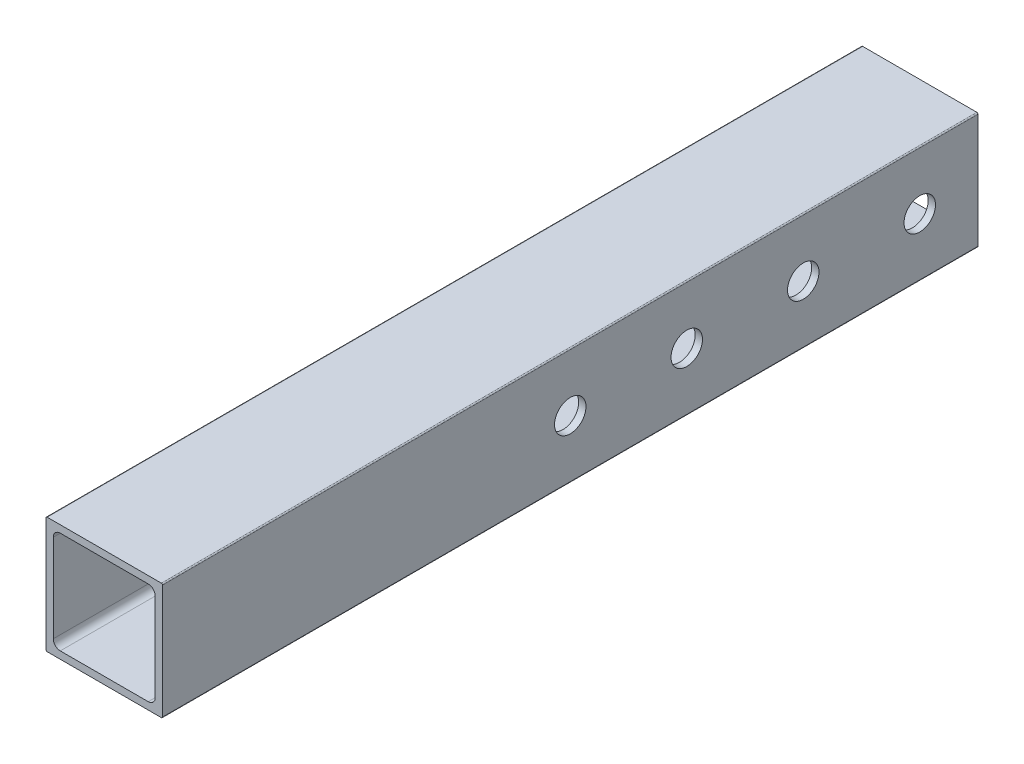
from build123d import *

# Parameters (mm, degrees)
BOSS_EXTRUDE1_DEPTH      = 88.9
BOSS_EXTRUDE1_DEPTH_BACK = 88.9
SKETCH2_R                = 3.429
CUT_EXTRUDE1_DEPTH       = 94.3255592


with BuildPart() as part:
    # Sketch1 → Boss-Extrude1 (new, two sides: drawn at the far end of the back side and taken through both)
    with BuildSketch(Plane.XY.offset(-BOSS_EXTRUDE1_DEPTH_BACK)):
        with BuildLine():
            Line((-12.446, -12.7), (12.446, -12.7))
            ThreePointArc((12.446, -12.7), (12.625605122, -12.625605122), (12.7, -12.446))
            Line((12.7, -12.446), (12.7, 12.446))
            ThreePointArc((12.7, 12.446), (12.625605122, 12.625605122), (12.446, 12.7))
            Line((12.446, 12.7), (-12.446, 12.7))
            ThreePointArc((-12.446, 12.7), (-12.625605122, 12.625605122), (-12.7, 12.446))
            Line((-12.7, 12.446), (-12.7, -12.446))
            ThreePointArc((-12.7, -12.446), (-12.625605122, -12.625605122), (-12.446, -12.7))
        make_face()
        with BuildLine():
            Line((-9.5885, 11.1125), (9.5885, 11.1125))
            ThreePointArc((9.5885, 11.1125), (10.666130735, 10.666130735), (11.1125, 9.5885))
            Line((11.1125, 9.5885), (11.1125, -9.5885))
            ThreePointArc((11.1125, -9.5885), (10.666130735, -10.666130735), (9.5885, -11.1125))
            Line((9.5885, -11.1125), (-9.5885, -11.1125))
            ThreePointArc((-9.5885, -11.1125), (-10.666130735, -10.666130735), (-11.1125, -9.5885))
            Line((-11.1125, -9.5885), (-11.1125, 9.5885))
            ThreePointArc((-11.1125, 9.5885), (-10.666130735, 10.666130735), (-9.5885, 11.1125))
        make_face(mode=Mode.SUBTRACT)
    extrude(amount=BOSS_EXTRUDE1_DEPTH + BOSS_EXTRUDE1_DEPTH_BACK)

    # Sketch2 → Cut-Extrude1 (cut, through all)
    with BuildSketch(Plane.ZY.offset(12.7)):
        with Locations((-76.2, 0)):
            Circle(SKETCH2_R)
        with Locations((-50.8, 0)):
            Circle(SKETCH2_R)
        with Locations((-25.4, 0)):
            Circle(SKETCH2_R)
        Circle(SKETCH2_R)
    extrude(amount=-CUT_EXTRUDE1_DEPTH, mode=Mode.SUBTRACT)


solid = part.part
